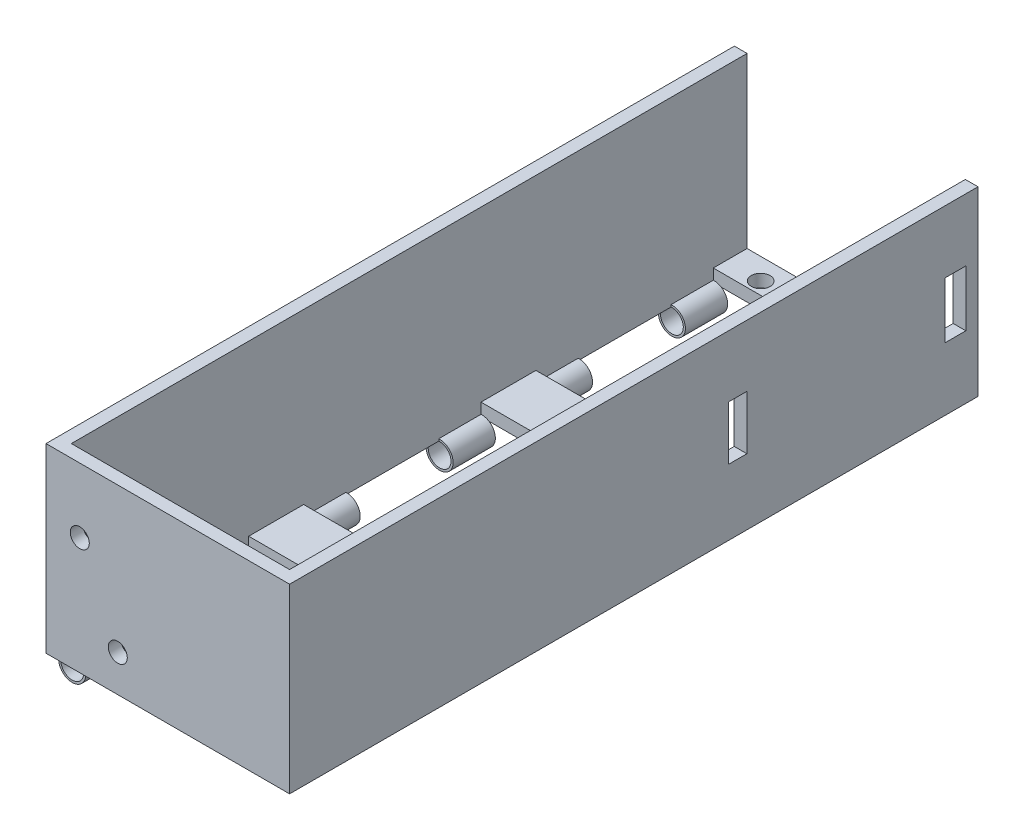
from build123d import *

# Parameters (mm, degrees)
BOSS_EXTRUDE1_DEPTH = 160
SKETCH2_W           = 49
SKETCH2_H           = 42
CUT_EXTRUDE1_DEPTH  = 175.467036895
BOSS_EXTRUDE2_DEPTH = 3
CUT_EXTRUDE2_REACH  = 179.222
SKETCH4_R           = 2.25
CUT_EXTRUDE3_REACH  = 178.518
SKETCH5_RX          = 2.25
SKETCH5_RY          = 2.22780983
SKETCH6_R           = 3.2
SKETCH6_R_2         = 2.7
BOSS_EXTRUDE3_DEPTH = 10
LPATTERN1_COUNT     = 3
LPATTERN1_PITCH     = 55
BOSS_EXTRUDE5_START = 10
SKETCH8_R           = 3.2
SKETCH8_R_2         = 2.7
BOSS_EXTRUDE5_DEPTH = 10
LPATTERN4_COUNT     = 3
LPATTERN4_PITCH     = 55
BOSS_EXTRUDE6_REACH = 179.222
SKETCH9_W           = 1.482443596
SKETCH9_H           = 10
SKETCH10_W          = 3
SKETCH10_H          = 5
BOSS_EXTRUDE7_DEPTH = 13
LPATTERN5_COUNT     = 3
LPATTERN5_PITCH     = 55
SKETCH11_R          = 1
CUT_EXTRUDE4_DEPTH  = 146.279444516
FILLET1_R           = 4
SKETCH12_W          = 13.45147454
SKETCH12_H          = 6.29040958
SKETCH12_W_2        = 11.5951942
SKETCH12_H_2        = 4.655434548
CUT_EXTRUDE5_DEPTH  = 177.518404158
SKETCH13_W          = 4.956575853
SKETCH13_H          = 13.302843662
SKETCH13_W_2        = 4.369397502
SKETCH13_H_2        = 12.795266669
SKETCH13_W_3        = 6.136964941
SKETCH13_H_3        = 15.145551293
CUT_EXTRUDE8_DEPTH  = 184.140929451


with BuildPart() as part:
    # Sketch1 → Boss-Extrude1 (new body)
    with BuildSketch(Plane.XY):
        Polygon((0, 0), (0, -10), (0, -40), (51.678578647, -40), (51.678578647, 0), (54.678578647, 0), (54.678578647, -43), (-3, -43), (-3, -10), (-3, 0), align=None)
    extrude(amount=BOSS_EXTRUDE1_DEPTH)

    # Sketch2 → Cut-Extrude1 (cut, through all)
    with BuildSketch(Plane(origin=(0, 0, 0), x_dir=(1, 0, 0), z_dir=(0, 1, 0))):
        with Locations((24.5, -29)):
            Rectangle(SKETCH2_W, SKETCH2_H)
        with Locations((24.5, -84)):
            Rectangle(SKETCH2_W, SKETCH2_H)
        with Locations((24.5, -139)):
            Rectangle(SKETCH2_W, SKETCH2_H)
    extrude(amount=-CUT_EXTRUDE1_DEPTH, mode=Mode.SUBTRACT)

    # Sketch3 → Boss-Extrude2 (add)
    with BuildSketch(Plane.XY.offset(160)):
        Polygon((-3, 0), (54.678578647, 0), (54.678578647, -43), (0, -43), (-3, -43), align=None)
    extrude(amount=BOSS_EXTRUDE2_DEPTH)

    # Sketch4 → Cut-Extrude2 (cut, up to next)
    with BuildSketch(Plane.XY.offset(163), mode=Mode.PRIVATE) as cut_extrude2_sk1:
        with Locations((14, -34.29951212)):
            Circle(SKETCH4_R)
    cut_extrude2_tool1 = extrude(cut_extrude2_sk1.sketch, amount=-CUT_EXTRUDE2_REACH, mode=Mode.PRIVATE) & part.part
    # Sketch4 → Cut-Extrude2 (cut, up to next)
    with BuildSketch(Plane.XY.offset(163), mode=Mode.PRIVATE) as cut_extrude2_sk2:
        with Locations((5, -15.310588783)):
            Circle(SKETCH4_R)
    cut_extrude2_tool2 = extrude(cut_extrude2_sk2.sketch, amount=-CUT_EXTRUDE2_REACH, mode=Mode.PRIVATE) & part.part
    add(cut_extrude2_tool1.solids().sort_by_distance((14, -34.299512, 163))[0], mode=Mode.SUBTRACT)
    add(cut_extrude2_tool2.solids().sort_by_distance((5, -15.310589, 163))[0], mode=Mode.SUBTRACT)

    # Sketch5 → Cut-Extrude3 (cut, up to next)
    with BuildSketch(Plane(origin=(0, -40, 0), x_dir=(1, 0, 0), z_dir=(0, 1, 0)), mode=Mode.PRIVATE) as cut_extrude3_sk1:
        with Locations(Location((8.280861004, -5.05395422), (0, 0, 180))):
            Ellipse(SKETCH5_RX, SKETCH5_RY)
    cut_extrude3_tool1 = extrude(cut_extrude3_sk1.sketch, amount=-CUT_EXTRUDE3_REACH, mode=Mode.PRIVATE) & part.part
    add(cut_extrude3_tool1.solids().sort_by_distance((8.280861, -40, 5.053954))[0], mode=Mode.SUBTRACT)

    # Sketch6 → Boss-Extrude3 (add)
    with BuildSketch(Plane.XY.offset(160)):
        with Locations((0.2, -45.7)):
            Circle(SKETCH6_R)
        with Locations((0.2, -45.7)):
            Circle(SKETCH6_R_2, mode=Mode.SUBTRACT)
    boss_extrude3 = extrude(amount=-BOSS_EXTRUDE3_DEPTH)

    # LPattern1: Boss-Extrude3 ×3
    with Locations(*[(0, 0, -i * LPATTERN1_PITCH) for i in range(1, LPATTERN1_COUNT)]):
        add(boss_extrude3)

    # Sketch8 → Boss-Extrude5 (add)
    with BuildSketch(Plane.XY.offset(118).offset(BOSS_EXTRUDE5_START)):
        with Locations((0.2, -45.7)):
            Circle(SKETCH8_R)
        with Locations((0.2, -45.7)):
            Circle(SKETCH8_R_2, mode=Mode.SUBTRACT)
    boss_extrude5 = extrude(amount=-BOSS_EXTRUDE5_DEPTH)

    # LPattern4: Boss-Extrude5 ×3
    with Locations(*[(0, 0, -i * LPATTERN4_PITCH) for i in range(1, LPATTERN4_COUNT)]):
        add(boss_extrude5)

    # Sketch9 → Boss-Extrude6 (add, up to next)
    with BuildSketch(Plane.XZ.offset(43), mode=Mode.PRIVATE) as boss_extrude6_sk1:
        with Locations((-2.258778202, 155)):
            Rectangle(SKETCH9_W, SKETCH9_H)
    boss_extrude6_tool1 = extrude(boss_extrude6_sk1.sketch, amount=BOSS_EXTRUDE6_REACH, mode=Mode.PRIVATE) - part.part
    # Sketch9 → Boss-Extrude6 (add, up to next)
    with BuildSketch(Plane.XZ.offset(43), mode=Mode.PRIVATE) as boss_extrude6_sk2:
        with Locations((-2.258778202, 100)):
            Rectangle(SKETCH9_W, SKETCH9_H)
    boss_extrude6_tool2 = extrude(boss_extrude6_sk2.sketch, amount=BOSS_EXTRUDE6_REACH, mode=Mode.PRIVATE) - part.part
    # Sketch9 → Boss-Extrude6 (add, up to next)
    with BuildSketch(Plane.XZ.offset(43), mode=Mode.PRIVATE) as boss_extrude6_sk3:
        with Locations((-2.258778202, 123)):
            Rectangle(SKETCH9_W, SKETCH9_H)
    boss_extrude6_tool3 = extrude(boss_extrude6_sk3.sketch, amount=BOSS_EXTRUDE6_REACH, mode=Mode.PRIVATE) - part.part
    # Sketch9 → Boss-Extrude6 (add, up to next)
    with BuildSketch(Plane.XZ.offset(43), mode=Mode.PRIVATE) as boss_extrude6_sk4:
        with Locations((-2.258778202, 68)):
            Rectangle(SKETCH9_W, SKETCH9_H)
    boss_extrude6_tool4 = extrude(boss_extrude6_sk4.sketch, amount=BOSS_EXTRUDE6_REACH, mode=Mode.PRIVATE) - part.part
    # Sketch9 → Boss-Extrude6 (add, up to next)
    with BuildSketch(Plane.XZ.offset(43), mode=Mode.PRIVATE) as boss_extrude6_sk5:
        with Locations((-2.258778202, 45)):
            Rectangle(SKETCH9_W, SKETCH9_H)
    boss_extrude6_tool5 = extrude(boss_extrude6_sk5.sketch, amount=BOSS_EXTRUDE6_REACH, mode=Mode.PRIVATE) - part.part
    # Sketch9 → Boss-Extrude6 (add, up to next)
    with BuildSketch(Plane.XZ.offset(43), mode=Mode.PRIVATE) as boss_extrude6_sk6:
        with Locations((-2.258778202, 13)):
            Rectangle(SKETCH9_W, SKETCH9_H)
    boss_extrude6_tool6 = extrude(boss_extrude6_sk6.sketch, amount=BOSS_EXTRUDE6_REACH, mode=Mode.PRIVATE) - part.part
    add(boss_extrude6_tool1.solids().sort_by_distance((-2.258778, -43, 155))[0])
    add(boss_extrude6_tool2.solids().sort_by_distance((-2.258778, -43, 100))[0])
    add(boss_extrude6_tool3.solids().sort_by_distance((-2.258778, -43, 123))[0])
    add(boss_extrude6_tool4.solids().sort_by_distance((-2.258778, -43, 68))[0])
    add(boss_extrude6_tool5.solids().sort_by_distance((-2.258778, -43, 45))[0])
    add(boss_extrude6_tool6.solids().sort_by_distance((-2.258778, -43, 13))[0])

    # Sketch10 → Boss-Extrude7 (add)
    with BuildSketch(Plane.ZY.offset(3)):
        with Locations((123.9, -45.5)):
            Rectangle(SKETCH10_W, SKETCH10_H)
        with Locations((123.9, -17.9)):
            Rectangle(SKETCH10_W, SKETCH10_H)
    boss_extrude7 = extrude(amount=BOSS_EXTRUDE7_DEPTH)

    # LPattern5: Boss-Extrude7 ×3
    with Locations(*[(0, 0, -i * LPATTERN5_PITCH) for i in range(1, LPATTERN5_COUNT)]):
        add(boss_extrude7)

    # Sketch11 → Cut-Extrude4 (cut, through all)
    with BuildSketch(Plane.XY.offset(125.4)):
        with Locations((-9.2, -45.95)):
            Circle(SKETCH11_R)
        with Locations((-9.2, -17.45)):
            Circle(SKETCH11_R)
    extrude(amount=-CUT_EXTRUDE4_DEPTH, mode=Mode.SUBTRACT)

    # Fillet1
    # the kernel refuses this fillet: 4 mm, written as the material it adds along each edge
    with BuildSketch(Plane(origin=(-3, -15.4, 122.4), x_dir=(0, 1, 0), z_dir=(0, 0, 1)), Plane(origin=(-3, -15.4, 12.4), x_dir=(0, 1, 0), z_dir=(0, 0, 1)), Plane(origin=(-3, -15.4, 67.4), x_dir=(0, 1, 0), z_dir=(0, 0, 1))) as fillet1_piece_1:
        with BuildLine():
            CenterArc((FILLET1_R, FILLET1_R), FILLET1_R, 180, 90)
            Line((0, FILLET1_R), (0, 0))
            Line((0, 0), (FILLET1_R, 0))
        make_face()
    extrude(amount=3)
    with BuildSketch(Plane(origin=(-3, -20.4, 122.4), x_dir=(0, 0, -1), z_dir=(0, 1, 0)), Plane(origin=(-3, -20.4, 12.4), x_dir=(0, 0, -1), z_dir=(0, 1, 0)), Plane(origin=(-3, -20.4, 67.4), x_dir=(0, 0, -1), z_dir=(0, 1, 0))) as fillet1_piece_2:
        with BuildLine():
            CenterArc((FILLET1_R, FILLET1_R), FILLET1_R, 180, 90)
            Line((0, FILLET1_R), (0, 0))
            Line((0, 0), (FILLET1_R, 0))
        make_face()
    extrude(amount=5)
    with BuildSketch(Plane(origin=(-3, -55.7, 122.4), x_dir=(0, 0, -1), z_dir=(0, 1, 0))) as fillet1_piece_3_section:
        with BuildLine():
            CenterArc((FILLET1_R, FILLET1_R), FILLET1_R, 180, 90)
            Line((0, FILLET1_R), (0, 0))
            Line((0, 0), (FILLET1_R, 0))
        make_face()
    fillet1_piece_3 = extrude(amount=12.7, mode=Mode.PRIVATE)
    fillet1_piece_3 = split(fillet1_piece_3, bisect_by=Plane(origin=(-3, -45.5, 121.586107481), z_dir=(-1, 0, 0)), keep=Keep.TOP, mode=Mode.PRIVATE)
    fillet1_piece_3 = split(fillet1_piece_3, bisect_by=Plane(origin=(-3.987804201, -48, 121.586107481), z_dir=(0, 1, 0)), keep=Keep.TOP, mode=Mode.PRIVATE)
    add(fillet1_piece_3)
    with BuildSketch(Plane(origin=(-3, -55.7, 12.4), x_dir=(0, 0, -1), z_dir=(0, 1, 0))) as fillet1_piece_4_section:
        with BuildLine():
            CenterArc((FILLET1_R, FILLET1_R), FILLET1_R, 180, 90)
            Line((0, FILLET1_R), (0, 0))
            Line((0, 0), (FILLET1_R, 0))
        make_face()
    fillet1_piece_4 = extrude(amount=12.7, mode=Mode.PRIVATE)
    fillet1_piece_4 = split(fillet1_piece_4, bisect_by=Plane(origin=(-3, -45.5, 11.586107481), z_dir=(-1, 0, 0)), keep=Keep.TOP, mode=Mode.PRIVATE)
    fillet1_piece_4 = split(fillet1_piece_4, bisect_by=Plane(origin=(-3.987804201, -48, 11.586107481), z_dir=(0, 1, 0)), keep=Keep.TOP, mode=Mode.PRIVATE)
    add(fillet1_piece_4)
    with BuildSketch(Plane(origin=(-3, -55.7, 67.4), x_dir=(0, 0, -1), z_dir=(0, 1, 0))) as fillet1_piece_5_section:
        with BuildLine():
            CenterArc((FILLET1_R, FILLET1_R), FILLET1_R, 180, 90)
            Line((0, FILLET1_R), (0, 0))
            Line((0, 0), (FILLET1_R, 0))
        make_face()
    fillet1_piece_5 = extrude(amount=12.7, mode=Mode.PRIVATE)
    fillet1_piece_5 = split(fillet1_piece_5, bisect_by=Plane(origin=(-3, -45.5, 66.586107481), z_dir=(-1, 0, 0)), keep=Keep.TOP, mode=Mode.PRIVATE)
    fillet1_piece_5 = split(fillet1_piece_5, bisect_by=Plane(origin=(-3.987804201, -48, 66.586107481), z_dir=(0, 1, 0)), keep=Keep.TOP, mode=Mode.PRIVATE)
    add(fillet1_piece_5)
    with BuildSketch(Plane(origin=(-3, -15.4, 112.4), x_dir=(0, 1, 0), z_dir=(0, 0, 1))) as fillet1_piece_6a_section:
        with BuildLine():
            CenterArc((FILLET1_R, FILLET1_R), FILLET1_R, 180, 90)
            Line((0, FILLET1_R), (0, 0))
            Line((0, 0), (FILLET1_R, 0))
        make_face()
    fillet1_piece_6a = extrude(amount=13, mode=Mode.PRIVATE)
    fillet1_piece_6a = split(fillet1_piece_6a, bisect_by=Plane(origin=(-3.905580457, -14.494419543, 122.4), z_dir=(0, 0, -1)), keep=Keep.TOP, mode=Mode.PRIVATE)
    with BuildSketch(Plane(origin=(-3, -20.4, 122.4), x_dir=(0, 0, -1), z_dir=(0, 1, 0))) as fillet1_piece_6b_section:
        with BuildLine():
            CenterArc((FILLET1_R, FILLET1_R), FILLET1_R, 180, 90)
            Line((0, FILLET1_R), (0, 0))
            Line((0, 0), (FILLET1_R, 0))
        make_face()
    fillet1_piece_6b = extrude(amount=15, mode=Mode.PRIVATE)
    fillet1_piece_6b = split(fillet1_piece_6b, bisect_by=Plane(origin=(-3.905580457, -15.4, 121.494419543), z_dir=(0, 1, 0)), keep=Keep.TOP, mode=Mode.PRIVATE)
    fillet1_piece_6 = fillet1_piece_6a & fillet1_piece_6b
    add(fillet1_piece_6)
    with BuildSketch(Plane(origin=(-3, -15.4, 2.4), x_dir=(0, 1, 0), z_dir=(0, 0, 1))) as fillet1_piece_7a_section:
        with BuildLine():
            CenterArc((FILLET1_R, FILLET1_R), FILLET1_R, 180, 90)
            Line((0, FILLET1_R), (0, 0))
            Line((0, 0), (FILLET1_R, 0))
        make_face()
    fillet1_piece_7a = extrude(amount=13, mode=Mode.PRIVATE)
    fillet1_piece_7a = split(fillet1_piece_7a, bisect_by=Plane(origin=(-3.905580457, -14.494419543, 12.4), z_dir=(0, 0, -1)), keep=Keep.TOP, mode=Mode.PRIVATE)
    with BuildSketch(Plane(origin=(-3, -20.4, 12.4), x_dir=(0, 0, -1), z_dir=(0, 1, 0))) as fillet1_piece_7b_section:
        with BuildLine():
            CenterArc((FILLET1_R, FILLET1_R), FILLET1_R, 180, 90)
            Line((0, FILLET1_R), (0, 0))
            Line((0, 0), (FILLET1_R, 0))
        make_face()
    fillet1_piece_7b = extrude(amount=15, mode=Mode.PRIVATE)
    fillet1_piece_7b = split(fillet1_piece_7b, bisect_by=Plane(origin=(-3.905580457, -15.4, 11.494419543), z_dir=(0, 1, 0)), keep=Keep.TOP, mode=Mode.PRIVATE)
    fillet1_piece_7 = fillet1_piece_7a & fillet1_piece_7b
    add(fillet1_piece_7)
    with BuildSketch(Plane(origin=(-3, -15.4, 57.4), x_dir=(0, 1, 0), z_dir=(0, 0, 1))) as fillet1_piece_8a_section:
        with BuildLine():
            CenterArc((FILLET1_R, FILLET1_R), FILLET1_R, 180, 90)
            Line((0, FILLET1_R), (0, 0))
            Line((0, 0), (FILLET1_R, 0))
        make_face()
    fillet1_piece_8a = extrude(amount=13, mode=Mode.PRIVATE)
    fillet1_piece_8a = split(fillet1_piece_8a, bisect_by=Plane(origin=(-3.905580457, -14.494419543, 67.4), z_dir=(0, 0, -1)), keep=Keep.TOP, mode=Mode.PRIVATE)
    with BuildSketch(Plane(origin=(-3, -20.4, 67.4), x_dir=(0, 0, -1), z_dir=(0, 1, 0))) as fillet1_piece_8b_section:
        with BuildLine():
            CenterArc((FILLET1_R, FILLET1_R), FILLET1_R, 180, 90)
            Line((0, FILLET1_R), (0, 0))
            Line((0, 0), (FILLET1_R, 0))
        make_face()
    fillet1_piece_8b = extrude(amount=15, mode=Mode.PRIVATE)
    fillet1_piece_8b = split(fillet1_piece_8b, bisect_by=Plane(origin=(-3.905580457, -15.4, 66.494419543), z_dir=(0, 1, 0)), keep=Keep.TOP, mode=Mode.PRIVATE)
    fillet1_piece_8 = fillet1_piece_8a & fillet1_piece_8b
    add(fillet1_piece_8)

    # Sketch12 → Cut-Extrude5 (cut, through all)
    with BuildSketch(Plane(origin=(0, -40, 0), x_dir=(1, 0, 0), z_dir=(0, 1, 0))):
        with Locations((25.892423933, -6.026680472)):
            Rectangle(SKETCH12_W, SKETCH12_H)
        with Locations((25.266023287, -55.857541039)):
            Rectangle(SKETCH12_W_2, SKETCH12_H_2)
    extrude(amount=-CUT_EXTRUDE5_DEPTH, mode=Mode.SUBTRACT)

    # Sketch13 → Cut-Extrude8 (cut, through all)
    with BuildSketch(Plane.ZY.offset(-51.678578647)):
        with Locations((5.357325151, -21.442942739)):
            Rectangle(SKETCH13_W, SKETCH13_H)
        with Locations((56.905237557, -20.98749361)):
            Rectangle(SKETCH13_W_2, SKETCH13_H_2)
        with Locations((53.98636578, -260.284827018)):
            Rectangle(SKETCH13_W_3, SKETCH13_H_3)
    extrude(amount=-CUT_EXTRUDE8_DEPTH, mode=Mode.SUBTRACT)


solid = part.part
